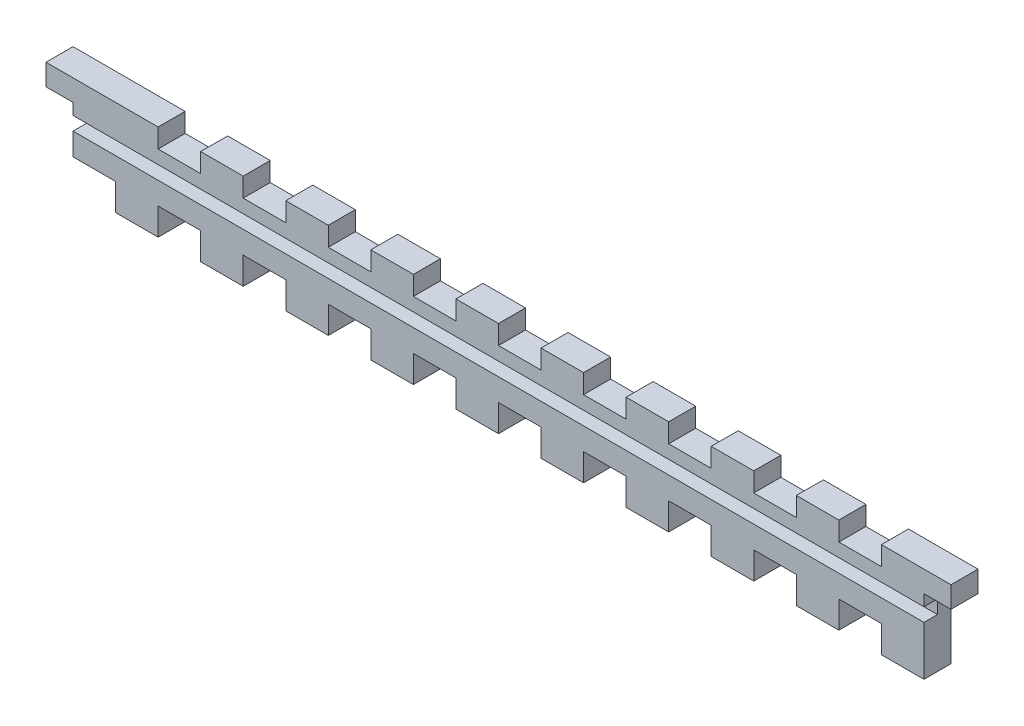
from build123d import *

# Parameters (mm, degrees)
BOSS_EXTRUDE1_START         = -11.086796564
BOSS_EXTRUDE1_OUTLINE_W     = 199.999998902
BOSS_EXTRUDE1_OUTLINE_H     = 6.35
BOSS_EXTRUDE1_DEPTH         = 11.596668503
BOSS_EXTRUDE1_START_2       = -17.436796564
BOSS_EXTRUDE1_2_OUTLINE_W   = 10
BOSS_EXTRUDE1_2_OUTLINE_H   = 6.35
BOSS_EXTRUDE1_2_OUTLINE_W_2 = 9.999999878
BOSS_EXTRUDE1_2_DEPTH       = 22.436796492
BOSS_EXTRUDE1_3_OUTLINE_W   = 16.35
BOSS_EXTRUDE1_3_OUTLINE_H   = 6.35
BOSS_EXTRUDE1_3_DEPTH       = 4.999999928
SKETCH2_W                   = 199.999998902
SKETCH2_H                   = 3.175
CUT_EXTRUDE1_DEPTH          = 3.175


# Read off the part's stored shape, not the designer's step: Boss-Extrude1
with BuildPart() as part:
    # Boss-Extrude1 outline → Boss-Extrude1 (new body)
    with BuildSketch(Plane(origin=(0, 0, 0), x_dir=(1, 0, 0), z_dir=(0, 1, 0)).offset(BOSS_EXTRUDE1_START)):
        with Locations((106.349999451, -3.175)):
            Rectangle(BOSS_EXTRUDE1_OUTLINE_W, BOSS_EXTRUDE1_OUTLINE_H)
    extrude(amount=BOSS_EXTRUDE1_DEPTH)



with BuildPart() as body_2:
    # Boss-Extrude1 2 outline → Boss-Extrude1 2 (new body)
    with BuildSketch(Plane(origin=(0, 0, 0), x_dir=(1, 0, 0), z_dir=(0, 1, 0)).offset(BOSS_EXTRUDE1_START_2)):
        Polygon((76.349999756, 0), (76.349999756, -6.35), (86.349999688, -6.35), (86.349999634, 0), align=None)
        Polygon((56.349999878, -6.35), (66.349999811, -6.35), (66.349999865, 0), (56.349999878, 0), align=None)
        Polygon((96.349999634, 0), (96.349999634, -6.35), (106.349999567, -6.35), (106.349999512, 0), align=None)
        Polygon((36.35, -6.35), (46.349999932, -6.35), (46.349999987, 0), (36.35, 0), align=None)
        Polygon((116.349999512, 0), (116.349999512, -6.35), (126.349999444, -6.35), (126.34999939, 0), align=None)
        with Locations((21.35, -3.175)):
            Rectangle(BOSS_EXTRUDE1_2_OUTLINE_W, BOSS_EXTRUDE1_2_OUTLINE_H)
        Polygon((136.34999939, 0), (136.34999939, -6.35), (146.349999322, -6.35), (146.349999268, 0), align=None)
        Polygon((156.349999268, 0), (156.349999268, -6.35), (166.349999201, -6.35), (166.349999146, 0), align=None)
        Polygon((176.349999146, 0), (176.349999146, -6.35), (186.349999078, -6.35), (186.349999024, 0), align=None)
        with Locations((201.349998963, -3.175)):
            Rectangle(BOSS_EXTRUDE1_2_OUTLINE_W_2, BOSS_EXTRUDE1_2_OUTLINE_H)
    extrude(amount=BOSS_EXTRUDE1_2_DEPTH)


with BuildPart() as part_1:
    add(part.part)

    add(body_2.part)  # Boss-Extrude1 3 merges body 2
    # Boss-Extrude1 3 outline → Boss-Extrude1 3 (add)
    with BuildSketch(Plane(origin=(0, 0, 0), x_dir=(1, 0, 0), z_dir=(0, 1, 0))):
        with Locations((8.175, -3.175)):
            Rectangle(BOSS_EXTRUDE1_3_OUTLINE_W, BOSS_EXTRUDE1_3_OUTLINE_H)
        Polygon((206.349998902, 0), (206.349998902, -6.35), (212.699998902, -6.35), (212.699998619, 0), align=None)
    extrude(amount=BOSS_EXTRUDE1_3_DEPTH)

    # Sketch2 → Cut-Extrude1 (cut)
    with BuildSketch(Plane.XY.offset(6.35)):
        with Locations((106.349999451, -4.252628114)):
            Rectangle(SKETCH2_W, SKETCH2_H)
    extrude(amount=-CUT_EXTRUDE1_DEPTH, mode=Mode.SUBTRACT)


solid = part_1.part
